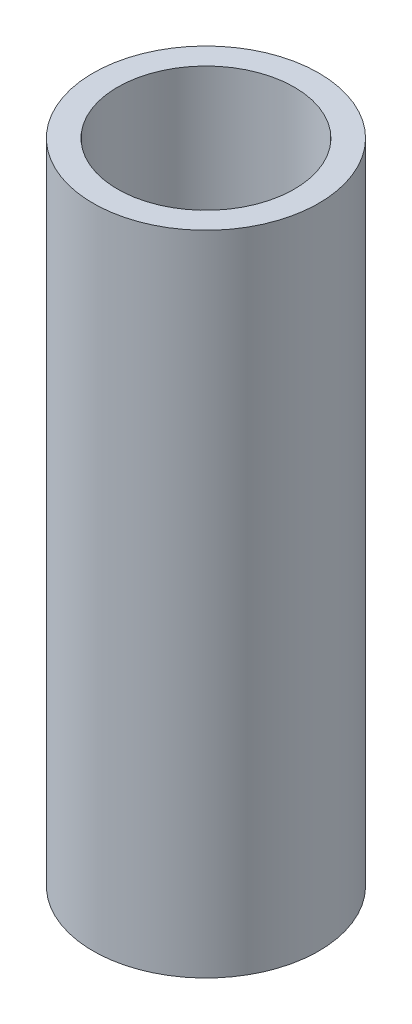
from build123d import *

# Parameters (mm, degrees)
SKETCH1_R           = 30
BOSS_EXTRUDE1_DEPTH = 172.12679781
SKETCH2_R           = 23.495130522
CUT_EXTRUDE1_DEPTH  = 178.27840964


with BuildPart() as part:
    # Sketch1 → Boss-Extrude1 (new body)
    with BuildSketch(Plane(origin=(0, 0, 0), x_dir=(1, 0, 0), z_dir=(0, 1, 0))):
        Circle(SKETCH1_R)
    extrude(amount=BOSS_EXTRUDE1_DEPTH)

    # Sketch2 → Cut-Extrude1 (cut, through all)
    with BuildSketch(Plane(origin=(0, 0, 0), x_dir=(1, 0, 0), z_dir=(0, 1, 0))):
        Circle(SKETCH2_R)
    extrude(amount=CUT_EXTRUDE1_DEPTH, mode=Mode.SUBTRACT)


solid = part.part
